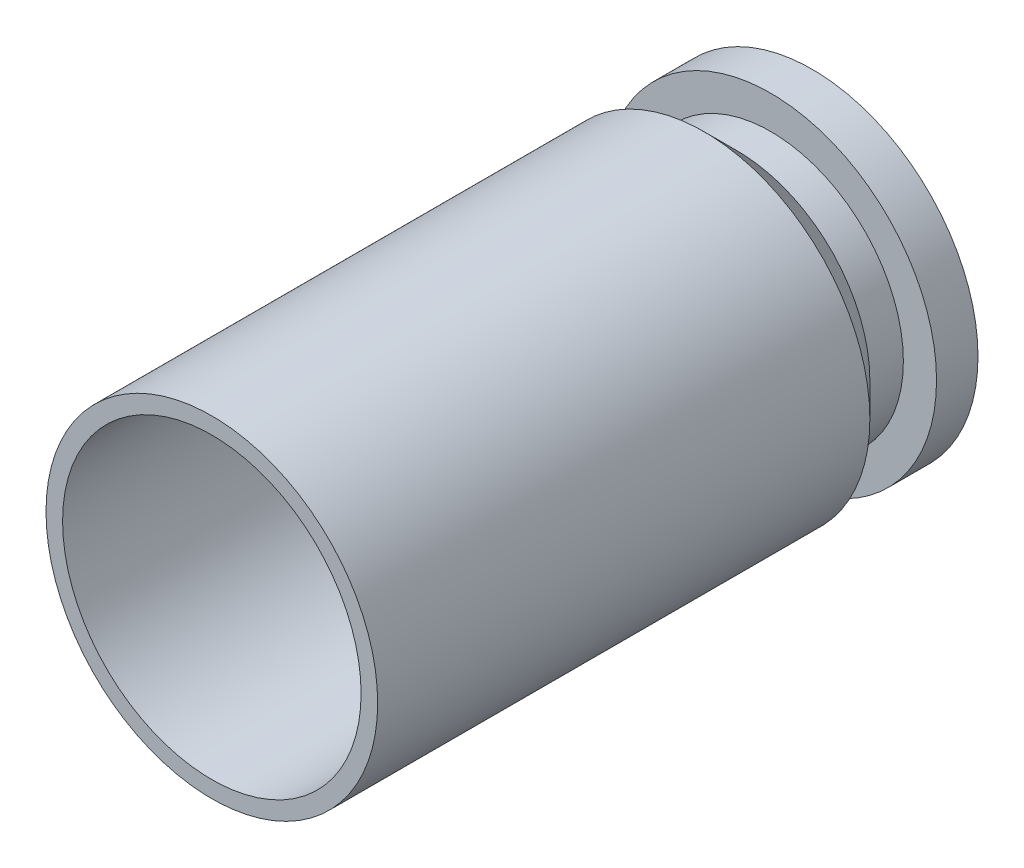
from build123d import *

# Parameters (mm, degrees)
SKETCH2_R          = 4.5
CUT_EXTRUDE1_DEPTH = 11
CHAMFER2_SIZE      = 2


with BuildPart() as part:
    # Sketch1 → Revolve1 (revolve)
    with BuildSketch(Plane(origin=(0, 0, 0), x_dir=(0, 0, -1), z_dir=(1, 0, 0)), mode=Mode.PRIVATE) as revolve1_sk:
        Polygon((16.85, -5), (18.1, -5), (18.1, 0), (0, 0), (0, -5), (16.84, -5), (16.84, -4), (16.85, -4), align=None)
    revolve(revolve1_sk.sketch.rotate(Axis((0, 0, 0), (0, 0, -1)), 270), axis=Axis((0, 0, 0), (0, 0, -1)))

    # Sketch2 → Cut-Extrude1 (cut)
    with BuildSketch(Plane.XY):
        Circle(SKETCH2_R)
    extrude(amount=-CUT_EXTRUDE1_DEPTH, mode=Mode.SUBTRACT)

    # Chamfer2
    # the kernel refuses this chamfer: 2 mm, written as the material it takes off along each edge
    with BuildSketch(Plane(origin=(0, 0, -16.84), x_dir=(1, 0, 0), z_dir=(0, 1, 0))) as chamfer2_piece_1_section:
        Polygon((5 - CHAMFER2_SIZE, 0), (5, -CHAMFER2_SIZE), (5, 0), align=None)
    chamfer2_piece_1 = revolve(axis=Axis((0, 0, -16.84), (0, 0, -1)), mode=Mode.PRIVATE)
    chamfer2_piece_1 = chamfer2_piece_1 - Plane(origin=(0, 0, -15.337254953), x_dir=(1, 0, 0), z_dir=(0, 0, -1)) * Cylinder(4, 20, mode=Mode.PRIVATE)
    add(chamfer2_piece_1, mode=Mode.SUBTRACT)


solid = part.part
